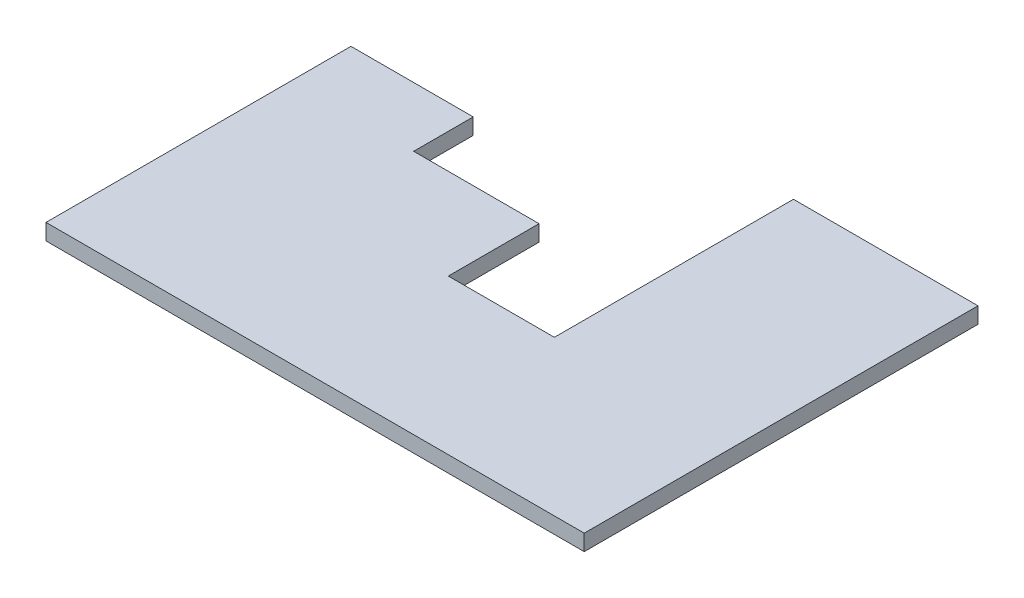
from build123d import *

# Parameters (mm, degrees)
BOSS_EXTRUDE1_DEPTH = 2.9
SKETCH2_W           = 15.24
SKETCH2_H           = 1.45
CUT_EXTRUDE1_DEPTH  = 1.45
FILLET2_R           = 2.54


with BuildPart() as part:
    # Sketch1 → Boss-Extrude1 (new body)
    with BuildSketch(Plane(origin=(0, 0, 0), x_dir=(1, 0, 0), z_dir=(0, 1, 0))):
        Polygon((0, 0), (0, 55.080000076), (22.080000036, 55.080000076), (22.080000036, 44.32387376), (44.723008852, 44.32387376), (44.723008852, 27.937097796), (63.88136576, 27.937097796), (63.88136576, 71.117097796), (97.207622704, 71.117097796), (97.207622704, 0), align=None)
    extrude(amount=BOSS_EXTRUDE1_DEPTH)

    # Sketch2 → Cut-Extrude1 (cut)
    with BuildSketch(Plane(origin=(0, 0, -27.937097796), x_dir=(-1, 0, 0), z_dir=(0, 0, -1))):
        with Locations((-54.302187306, 0.725)):
            Rectangle(SKETCH2_W, SKETCH2_H)
    extrude(amount=-CUT_EXTRUDE1_DEPTH, mode=Mode.SUBTRACT)

    # Fillet2
    # the kernel refuses this fillet: 2.54 mm, written as the material it adds along each edge
    with BuildSketch(Plane(origin=(65.547187306, 1.45, -26.487097796), x_dir=(0, -1, 0), z_dir=(-1, 0, 0))) as fillet2_piece_1:
        with BuildLine():
            CenterArc((2.368220922, -2.368220922), FILLET2_R, 111.192609021, 47.614781958)
            Line((0, -1.45), (0, 0))
            Line((0, 0), (1.45, 0))
        make_face()
    extrude(amount=22.49)


solid = part.part
